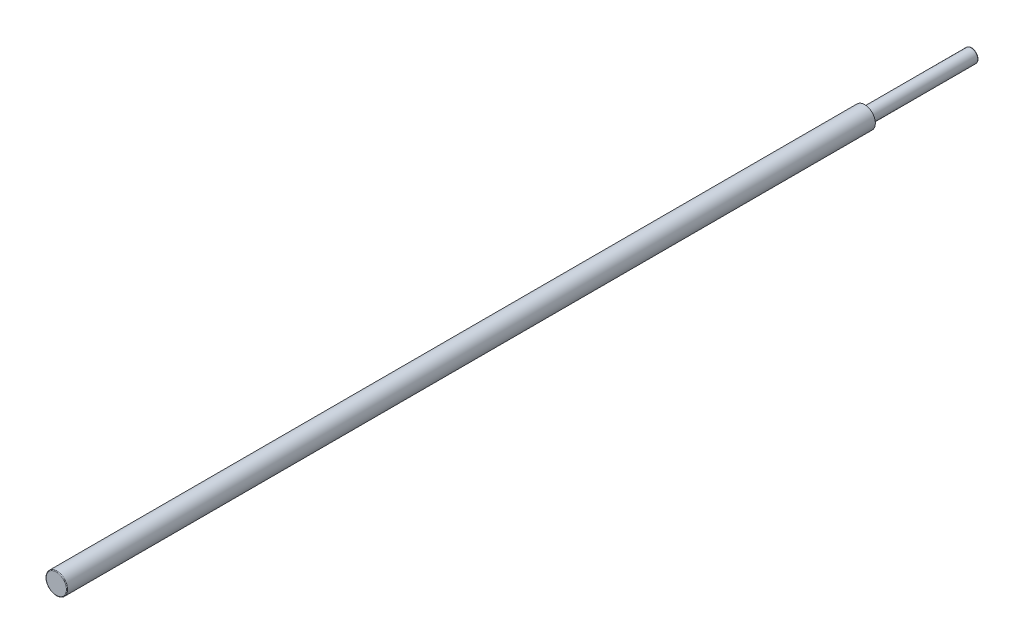
from build123d import *

# Parameters (mm, degrees)
SKETCH1_R           = 2.5
EXTRUDE1_DEPTH      = 40
SKETCH2_R           = 4
BOSS_EXTRUDE1_DEPTH = 302
FILLET1_R           = 0.25


with BuildPart() as part:
    # Sketch1 → Extrude1 (new body)
    with BuildSketch(Plane.XY):
        Circle(SKETCH1_R)
    extrude(amount=EXTRUDE1_DEPTH)

    # Sketch2 → Boss-Extrude1 (add)
    with BuildSketch(Plane.XY.offset(40)):
        Circle(SKETCH2_R)
    extrude(amount=BOSS_EXTRUDE1_DEPTH)

    # Fillet1
    fillet1_edges = [part.edges().sort_by_distance(p)[0] for p in [
        (-4, 0, 342),
        (-2.5, 0, 0),
    ]]
    fillet(fillet1_edges, radius=FILLET1_R)


solid = part.part
